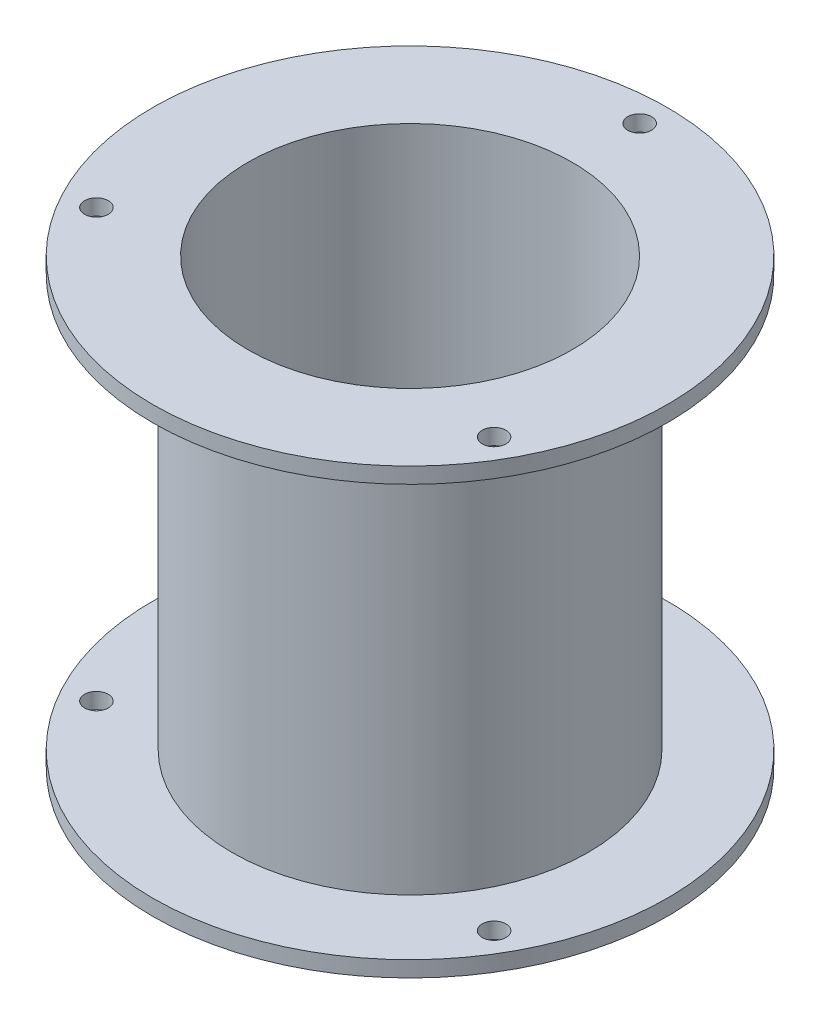
from build123d import *

# Parameters (mm, degrees)
SKETCH1_R           = 32.5
BOSS_EXTRUDE1_DEPTH = 56
CUT_EXTRUDE4_START  = -54
SKETCH6_R           = 32.5
SKETCH6_R_2         = 22.5
CUT_EXTRUDE4_DEPTH  = 52
SKETCH2_R           = 1.5
CUT_EXTRUDE2_DEPTH  = 73.446532008
SHELL1_OUTLINE_R    = 20.5
SHELL1_DEPTH        = 56


# Read off the part's stored shape, not the designer's step: Shell1
with BuildPart() as part:
    # Sketch1 → Boss-Extrude1 (new body)
    with BuildSketch(Plane(origin=(0, 0, 0), x_dir=(1, 0, 0), z_dir=(0, 1, 0))):
        with Locations(Location((0, 0, 0), (0, 0, 270))):
            Circle(SKETCH1_R)
    extrude(amount=BOSS_EXTRUDE1_DEPTH)

    # Sketch6 → Cut-Extrude4 (cut)
    with BuildSketch(Plane(origin=(0, 56, 0), x_dir=(1, 0, 0), z_dir=(0, 1, 0)).offset(CUT_EXTRUDE4_START)):
        with Locations(Location((0, 0, 0), (0, 0, 270))):
            Circle(SKETCH6_R)
        with Locations(Location((0, 0, 0), (0, 0, 270))):
            Circle(SKETCH6_R_2, mode=Mode.SUBTRACT)
    extrude(amount=CUT_EXTRUDE4_DEPTH, mode=Mode.SUBTRACT)

    # Sketch2 → Cut-Extrude2 (cut, through all)
    with BuildSketch(Plane(origin=(0, 56, 0), x_dir=(1, 0, 0), z_dir=(0, 1, 0))):
        with Locations(Location((0, 29, 0), (0, 0, 270))):
            Circle(SKETCH2_R)
        with Locations(Location((-25.11473671, -14.5, 0), (0, 0, 270))):
            Circle(SKETCH2_R)
        with Locations(Location((25.11473671, -14.5, 0), (0, 0, 270))):
            Circle(SKETCH2_R)
    extrude(amount=-CUT_EXTRUDE2_DEPTH, mode=Mode.SUBTRACT)

    # Shell1 outline → Shell1 (cut)
    with BuildSketch(Plane(origin=(0, 0, 0), x_dir=(1, 0, 0), z_dir=(0, 1, 0))):
        Circle(SHELL1_OUTLINE_R)
    extrude(amount=SHELL1_DEPTH, mode=Mode.SUBTRACT)


solid = part.part
